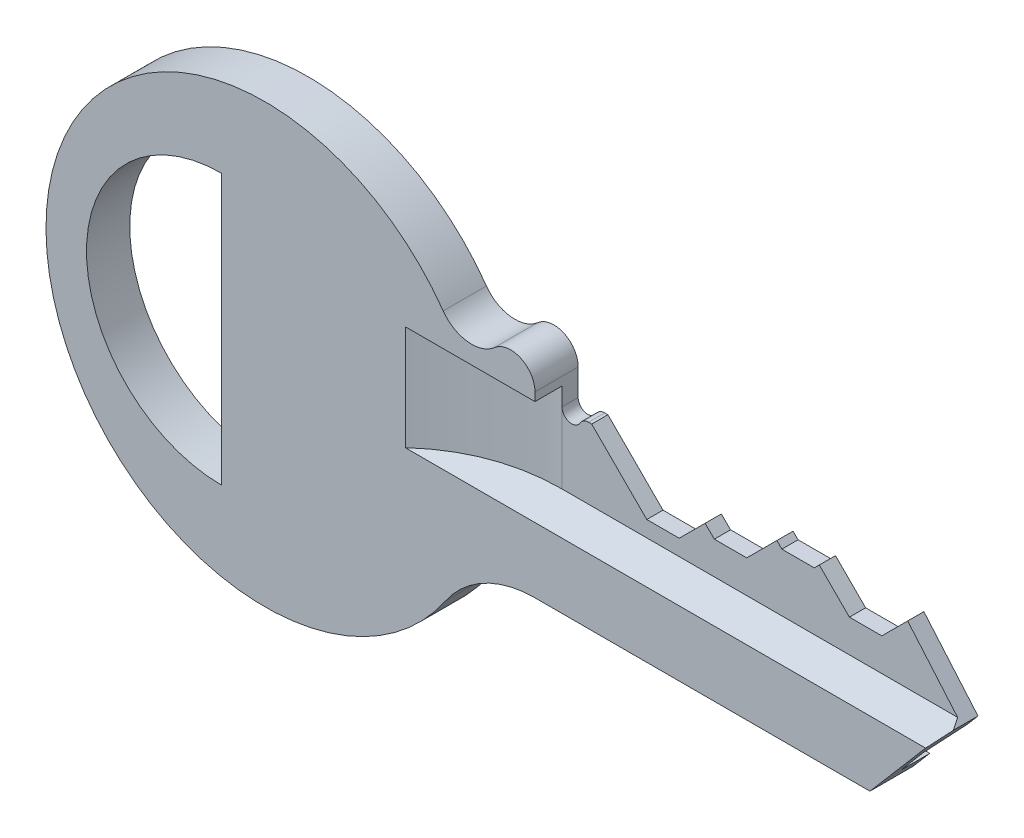
from build123d import *

# Parameters (mm, degrees)
BOSS_EXTRUDE1_DEPTH = 2.032
CUT_EXTRUDE2_DEPTH  = 24.892
FILLET1_R           = 15.24
CUT_EXTRUDE3_DEPTH  = 27.869973793


with BuildPart() as part:
    # Sketch1 → Boss-Extrude1 (new body)
    with BuildSketch(Plane.XY):
        with BuildLine():
            Line((0, 0), (15.748, 0))
            Line((15.748, 0), (18.796, 3.5687))
            Line((18.796, 3.5687), (15.748, 7.1374))
            Line((15.748, 7.1374), (1.249093629, 7.1374))
            ThreePointArc((1.249093629, 7.1374), (1.020493629, 7.076146815), (0.853146815, 6.9088))
            ThreePointArc((0.853146815, 6.9088), (0.338867933, 6.695778712), (0, 7.1374))
            Line((0, 7.1374), (0, 8.382))
            ThreePointArc((0, 8.382), (-0.671156766, 9.42306338), (-1.896435629, 9.241525307))
            ThreePointArc((-1.896435629, 9.241525307), (-3.167624386, 8.846252494), (-4.312815757, 9.525))
            ThreePointArc((-4.312815757, 9.525), (-22.986492034, 3.466471629), (-4.196095201, -2.219734364))
            ThreePointArc((-4.196095201, -2.219734364), (-2.373522466, -0.589120746), (0, 0))
        make_face()
        with BuildLine():
            Line((-14.732, 9.9187), (-14.732, -2.7813))
            ThreePointArc((-14.732, -2.7813), (-21.082, 3.5687), (-14.732, 9.9187))
        make_face(mode=Mode.SUBTRACT)
    extrude(amount=BOSS_EXTRUDE1_DEPTH)

    # Sketch2 → Cut-Extrude2 (cut)
    with BuildSketch(Plane(origin=(18.796, 0, 0), x_dir=(0, 0, -1), z_dir=(1, 0, 0))):
        Polygon((0, 0.9144), (-1.3589, 0.9144), (-1.3589, 2.1844), (0, 2.968961281), align=None)
        Polygon((-0.762, 3.7973), (-2.032, 3.064065158), (-2.032, 7.9883), (-0.762, 7.9883), align=None)
    extrude(amount=-CUT_EXTRUDE2_DEPTH, mode=Mode.SUBTRACT)

    # Fillet1
    # the kernel refuses this fillet: 15.24 mm, written as the material it adds along each edge
    with BuildSketch(Plane(origin=(-6.096, 0.9144, 1.3589), x_dir=(0, 0, -1), z_dir=(0, 1, 0))) as fillet1_piece_1_section:
        with BuildLine():
            CenterArc((15.24, -6.29068063), FILLET1_R, 155.620767223, 24.379232777)
            Line((0, -6.29068063), (-0.3048, -6.29068063))
            Line((-0.3048, -6.29068063), (-0.3048, 0))
            Line((-0.3048, 0), (0, 0.3048))
            ThreePointArc((0, 0.3048), (0.67945, 0.3048), (1.081278, 0.125813613))
            Line((1.081278, 0.125813613), (1.3589, 0))
        make_face()
    fillet1_piece_1 = extrude(amount=16.996701575, mode=Mode.PRIVATE)
    fillet1_piece_1 = split(fillet1_piece_1, bisect_by=Plane(origin=(-4.21750285, 2.15532175, 1.409265006), z_dir=(0, -0.8660254037844416, -0.49999999999999506)), keep=Keep.TOP, mode=Mode.PRIVATE)
    add(fillet1_piece_1)
    with BuildSketch(Plane(origin=(-6.096, 7.9883, 0.762), x_dir=(0, 0, 1), z_dir=(0, -1, 0))) as fillet1_piece_2_section:
        with BuildLine():
            CenterArc((15.24, -6.090706035), FILLET1_R, 156.443535691, 23.556464309)
            Line((0, -6.090706035), (-0.3048, -6.090706035))
            Line((-0.3048, -6.090706035), (-0.3048, 0))
            Line((-0.3048, 0), (0, 0.3048))
            ThreePointArc((0, 0.3048), (0.635, 0.3048), (0.9906, 0.121814121))
            Line((0.9906, 0.121814121), (1.27, 0))
        make_face()
    fillet1_piece_2 = extrude(amount=19.417765087, mode=Mode.PRIVATE)
    fillet1_piece_2 = split(fillet1_piece_2, bisect_by=Plane(origin=(-4.154309829, 4.225398766, 0.020511187), z_dir=(0, 0.8660254037844416, 0.49999999999999506)), keep=Keep.TOP, mode=Mode.PRIVATE)
    add(fillet1_piece_2)

    # Sketch3 → Cut-Extrude3 (cut, through all)
    with BuildSketch(Plane.XY.offset(0.762)):
        Polygon((18.796, 7.9883), (18.796, 3.5687), (16.25112476, 6.54832476), (15.0368, 5.334), (13.5128, 5.334), (12.09675, 6.75005), (11.8618, 6.5151), (10.3378, 6.5151), (10.10285, 6.75005), (8.6868, 5.334), (7.1628, 5.334), (6.731, 5.7658), (5.5118, 4.5466), (3.9878, 4.5466), (0.5461, 7.9883), align=None)
    extrude(amount=-CUT_EXTRUDE3_DEPTH, mode=Mode.SUBTRACT)


solid = part.part
